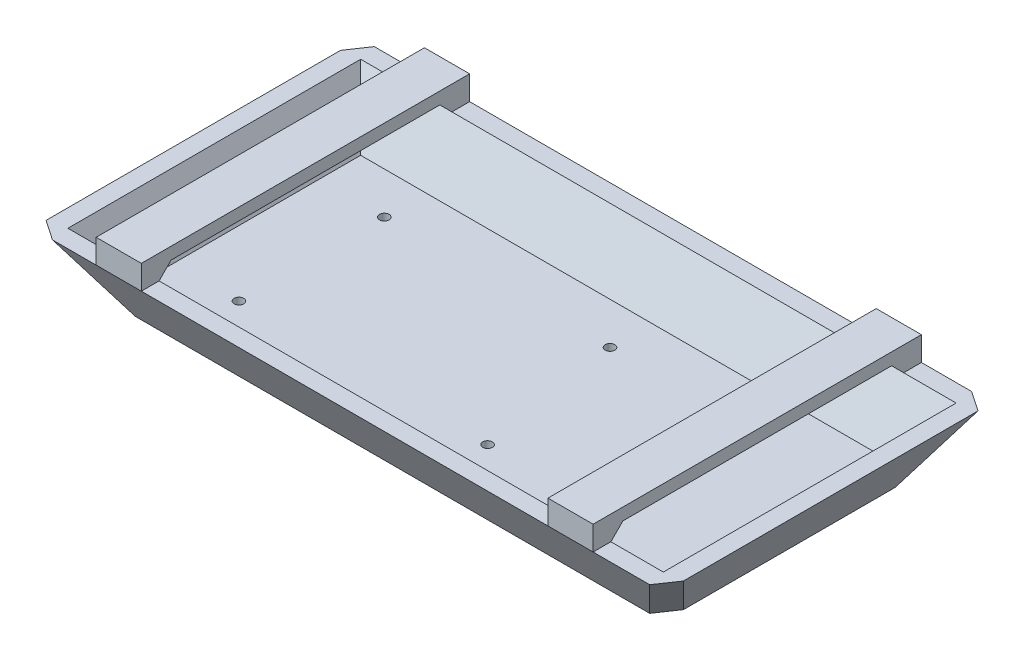
from build123d import *
from OCP.BRepFilletAPI import BRepFilletAPI_MakeChamfer

# Parameters (mm, degrees)
SKETCH1_W           = 182
SKETCH1_H           = 81.5
BOSS_EXTRUDE1_DEPTH = 22
BOSS_EXTRUDE1_DRAFT = -32
SHELL1_T            = -5
SKETCH2_R           = 1.6
CUT_EXTRUDE1_DEPTH  = 22
CHAMFER1_SIZE       = 4
CHAMFER1_SIZE2      = 5.891470361
SKETCH3_W           = 15
SKETCH3_H           = 5.895892017
BOSS_EXTRUDE2_DEPTH = 8
SKETCH6_W           = 15
SKETCH6_H           = 4
BOSS_EXTRUDE3_DEPTH = 98
SKETCH7_W           = 15
SKETCH7_H           = 4
BOSS_EXTRUDE4_DEPTH = 98
CHAMFER2_SIZE       = 4


with BuildPart() as part:
    # Sketch1 → Boss-Extrude1 (with draft: the straight prism first)
    with BuildSketch(Plane(origin=(0, 0, 0), x_dir=(1, 0, 0), z_dir=(0, 1, 0))):
        Rectangle(SKETCH1_W, SKETCH1_H)
    extrude(amount=BOSS_EXTRUDE1_DEPTH)
    # Boss-Extrude1: the draft: its side faces are tilted about the plane it starts from
    boss_extrude1_sides = [part.faces().sort_by_distance(p)[0] for p in [
        (0, 11, 40.75),
        (91, 11, 0),
        (0, 11, -40.75),
        (-91, 11, 0),
    ]]
    draft(boss_extrude1_sides, Plane(origin=(0, 0, 0), x_dir=(1, 0, 0), z_dir=(0, 1, 0)), BOSS_EXTRUDE1_DRAFT)

    # Shell1
    shell1_openings = [part.faces().sort_by_distance(p)[0] for p in [
        (0, 22, 0),
    ]]
    offset(amount=SHELL1_T, openings=shell1_openings, kind=Kind.INTERSECTION)

    # Sketch2 → Cut-Extrude1 (cut)
    with BuildSketch(Plane(origin=(0, 5, 0), x_dir=(1, 0, 0), z_dir=(0, 1, 0))):
        with Locations(Location((-66.523454743, 24.138454743, 0), (0, 0, 270))):
            Circle(SKETCH2_R)
        with Locations(Location((-66.523454743, -24.141545257, 0), (0, 0, 270))):
            Circle(SKETCH2_R)
        with Locations(Location((8.406545257, 24.138454743, 0), (0, 0, 270))):
            Circle(SKETCH2_R)
        with Locations(Location((16.026545257, -24.141545257, 0), (0, 0, 270))):
            Circle(SKETCH2_R)
        with Locations(Location((46.506545257, 14.618454743, 0), (0, 0, 270))):
            Circle(SKETCH2_R)
    extrude(amount=-CUT_EXTRUDE1_DEPTH, mode=Mode.SUBTRACT)

    # Chamfer1: one chamfer whose edges measure the first distance from different faces: ONE call of the kernel's chamfer builder (chamfer() names one face for all edges)
    chamfer1_edges_1 = [part.edges().sort_by_distance(p)[0] for p in [
        (97.873562871, 11, 47.623562871),
    ]]
    chamfer1_side_1 = [part.faces().sort_by_distance(p)[0] for p in [
        (0, 11.257506349, 47.784470697),
    ]]
    chamfer1_edges_2 = [part.edges().sort_by_distance(p)[0] for p in [
        (-97.873562871, 11, 47.623562871),
    ]]
    chamfer1_side_2 = [part.faces().sort_by_distance(p)[0] for p in [
        (-98.204252581, 11.529214161, 0),
    ]]
    chamfer1_edges_3 = [part.edges().sort_by_distance(p)[0] for p in [
        (-97.873562871, 11, -47.623562871),
    ]]
    chamfer1_side_3 = [part.faces().sort_by_distance(p)[0] for p in [
        (0, 11.257506349, -47.784470697),
    ]]
    chamfer1_edges_4 = [part.edges().sort_by_distance(p)[0] for p in [
        (97.873562871, 11, -47.623562871),
    ]]
    chamfer1_side_4 = [part.faces().sort_by_distance(p)[0] for p in [
        (98.204252581, 11.529214161, 0),
    ]]
    chamfer1 = BRepFilletAPI_MakeChamfer(part.part.solid().wrapped)
    for e in chamfer1_edges_1:
        chamfer1.Add(CHAMFER1_SIZE, CHAMFER1_SIZE2, e.wrapped, chamfer1_side_1[0].wrapped)  # the first distance lies on this face
    for e in chamfer1_edges_2:
        chamfer1.Add(CHAMFER1_SIZE, CHAMFER1_SIZE2, e.wrapped, chamfer1_side_2[0].wrapped)  # the first distance lies on this face
    for e in chamfer1_edges_3:
        chamfer1.Add(CHAMFER1_SIZE, CHAMFER1_SIZE2, e.wrapped, chamfer1_side_3[0].wrapped)  # the first distance lies on this face
    for e in chamfer1_edges_4:
        chamfer1.Add(CHAMFER1_SIZE, CHAMFER1_SIZE2, e.wrapped, chamfer1_side_4[0].wrapped)  # the first distance lies on this face
    add(Compound.cast(chamfer1.Shape()), mode=Mode.REPLACE)

    # Sketch3 → Boss-Extrude2 (add)
    with BuildSketch(Plane(origin=(0, 22, 0), x_dir=(1, 0, 0), z_dir=(0, 1, 0))):
        with Locations((-76.070202855, 51.549179733)):
            Rectangle(SKETCH3_W, SKETCH3_H)
        with Locations((73.929797145, 51.549179733)):
            Rectangle(SKETCH3_W, SKETCH3_H)
        with Locations((-76.070202855, -51.549179733)):
            Rectangle(SKETCH3_W, SKETCH3_H)
        with Locations((73.929797145, -51.549179733)):
            Rectangle(SKETCH3_W, SKETCH3_H)
    extrude(amount=BOSS_EXTRUDE2_DEPTH)

    # Sketch6 → Boss-Extrude3 (add)
    with BuildSketch(Plane(origin=(0, 0, 48.601233725), x_dir=(-1, 0, 0), z_dir=(0, 0, -1))):
        with Locations((-73.929797145, 28)):
            Rectangle(SKETCH6_W, SKETCH6_H)
    extrude(amount=BOSS_EXTRUDE3_DEPTH)

    # Sketch7 → Boss-Extrude4 (add)
    with BuildSketch(Plane(origin=(0, 0, 48.601233725), x_dir=(-1, 0, 0), z_dir=(0, 0, -1))):
        with Locations((76.070202855, 28)):
            Rectangle(SKETCH7_W, SKETCH7_H)
    extrude(amount=BOSS_EXTRUDE4_DEPTH)

    # Chamfer2
    chamfer2_edges = [part.edges().sort_by_distance(p)[0] for p in [
        (-76.070202855, 26, 48.601233725),
        (-76.070202855, 26, -48.601233725),
        (73.929797145, 26, 48.601233725),
        (73.929797145, 26, -48.601233725),
    ]]
    chamfer(chamfer2_edges, length=CHAMFER2_SIZE - 0.0001)  # a hair under: the kernel refuses the full size


solid = part.part
